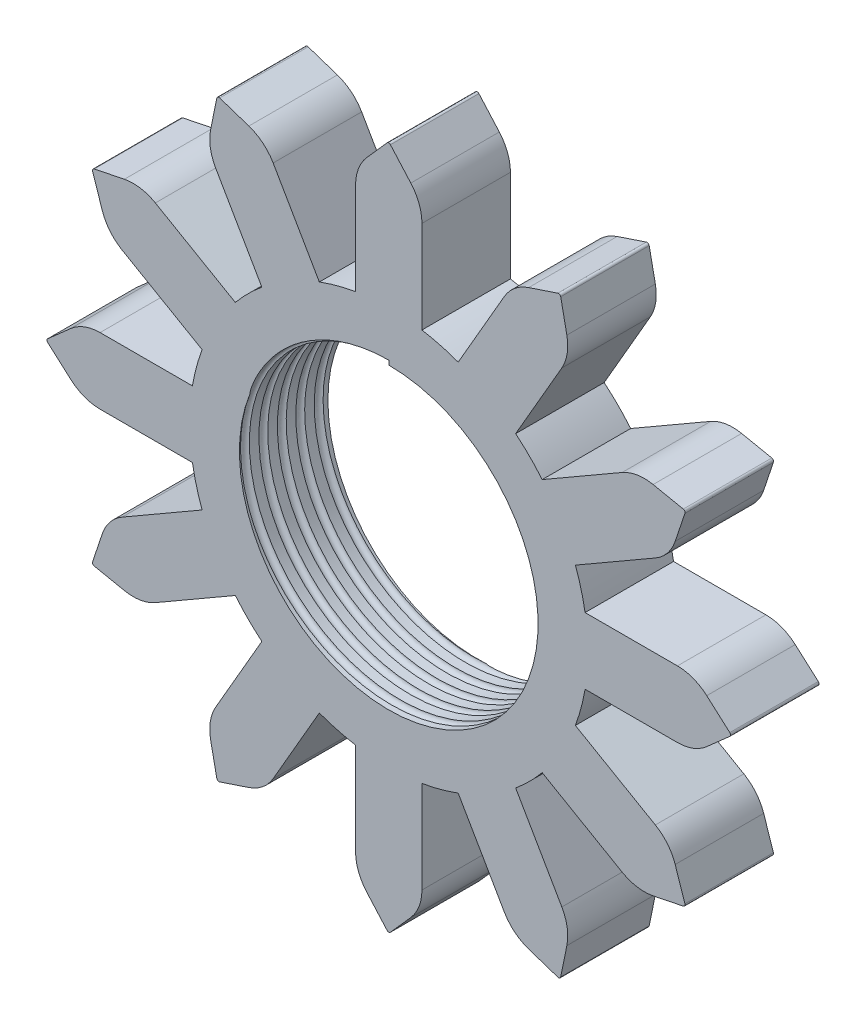
from build123d import *

# Parameters (mm, degrees)
SKETCH1_R           = 6.75
BOSS_EXTRUDE1_DEPTH = 4
CUT_SWEEP8_PITCH    = 0.8333333


with BuildPart() as part:
    # Sketch1 → Boss-Extrude1 (new body)
    with BuildSketch(Plane.XY):
        with BuildLine():
            Line((-0.074859453, 15.415479633), (-0.997189055, 14.374119675))
            ThreePointArc((-0.997189055, 14.374119675), (-1.370077286, 13.757155151), (-1.5, 13.048063517))
            Line((-1.5, 13.048063517), (-1.5, 8.874119675))
            ThreePointArc((-1.5, 8.874119675), (-2.329371406, 8.693332437), (-3.138021732, 8.435213074))
            Line((-3.138021732, 8.435213074), (-5.224993653, 12.049954476))
            ThreePointArc((-5.224993653, 12.049954476), (-5.692055841, 12.599084487), (-6.323468783, 12.946947323))
            Line((-6.323468783, 12.946947323), (-7.642909629, 13.3876267))
            ThreePointArc((-7.642909629, 13.3876267), (-7.724588412, 13.379379598), (-7.772570004, 13.312767247))
            Line((-7.772570004, 13.312767247), (-8.050650891, 11.949758268))
            ThreePointArc((-8.050650891, 11.949758268), (-8.06509931, 11.229007201), (-7.823069864, 10.549954476))
            Line((-7.823069864, 10.549954476), (-5.736097943, 6.935213074))
            ThreePointArc((-5.736097943, 6.935213074), (-6.363961031, 6.363961031), (-6.935213074, 5.736097943))
            Line((-6.935213074, 5.736097943), (-10.549954476, 7.823069864))
            ThreePointArc((-10.549954476, 7.823069864), (-11.229007201, 8.06509931), (-11.949758268, 8.050650891))
            Line((-11.949758268, 8.050650891), (-13.312767247, 7.772570004))
            ThreePointArc((-13.312767247, 7.772570004), (-13.379379598, 7.724588412), (-13.3876267, 7.642909629))
            Line((-13.3876267, 7.642909629), (-12.946947323, 6.323468783))
            ThreePointArc((-12.946947323, 6.323468783), (-12.599084487, 5.692055841), (-12.049954476, 5.224993653))
            Line((-12.049954476, 5.224993653), (-8.435213074, 3.138021732))
            ThreePointArc((-8.435213074, 3.138021732), (-8.693332437, 2.329371406), (-8.874119675, 1.5))
            Line((-8.874119675, 1.5), (-13.048063517, 1.5))
            ThreePointArc((-13.048063517, 1.5), (-13.757155151, 1.370077286), (-14.374119675, 0.997189055))
            Line((-14.374119675, 0.997189055), (-15.415479633, 0.074859453))
            ThreePointArc((-15.415479633, 0.074859453), (-15.449176825, 0), (-15.415479633, -0.074859453))
            Line((-15.415479633, -0.074859453), (-14.374119675, -0.997189055))
            ThreePointArc((-14.374119675, -0.997189055), (-13.757155151, -1.370077286), (-13.048063517, -1.5))
            Line((-13.048063517, -1.5), (-8.874119675, -1.5))
            ThreePointArc((-8.874119675, -1.5), (-8.693332437, -2.329371406), (-8.435213074, -3.138021732))
            Line((-8.435213074, -3.138021732), (-12.049954476, -5.224993653))
            ThreePointArc((-12.049954476, -5.224993653), (-12.599084487, -5.692055841), (-12.946947323, -6.323468783))
            Line((-12.946947323, -6.323468783), (-13.3876267, -7.642909629))
            ThreePointArc((-13.3876267, -7.642909629), (-13.379379598, -7.724588412), (-13.312767247, -7.772570004))
            Line((-13.312767247, -7.772570004), (-11.949758268, -8.050650891))
            ThreePointArc((-11.949758268, -8.050650891), (-11.229007201, -8.06509931), (-10.549954476, -7.823069864))
            Line((-10.549954476, -7.823069864), (-6.935213074, -5.736097943))
            ThreePointArc((-6.935213074, -5.736097943), (-6.363961031, -6.363961031), (-5.736097943, -6.935213074))
            Line((-5.736097943, -6.935213074), (-7.823069864, -10.549954476))
            ThreePointArc((-7.823069864, -10.549954476), (-8.06509931, -11.229007201), (-8.050650891, -11.949758268))
            Line((-8.050650891, -11.949758268), (-7.772570004, -13.312767247))
            ThreePointArc((-7.772570004, -13.312767247), (-7.724588412, -13.379379598), (-7.642909629, -13.3876267))
            Line((-7.642909629, -13.3876267), (-6.323468783, -12.946947323))
            ThreePointArc((-6.323468783, -12.946947323), (-5.692055841, -12.599084487), (-5.224993653, -12.049954476))
            Line((-5.224993653, -12.049954476), (-3.138021732, -8.435213074))
            ThreePointArc((-3.138021732, -8.435213074), (-2.329371406, -8.693332437), (-1.5, -8.874119675))
            Line((-1.5, -8.874119675), (-1.5, -13.048063517))
            ThreePointArc((-1.5, -13.048063517), (-1.370077286, -13.757155151), (-0.997189055, -14.374119675))
            Line((-0.997189055, -14.374119675), (-0.074859453, -15.415479633))
            ThreePointArc((-0.074859453, -15.415479633), (0, -15.449176825), (0.074859453, -15.415479633))
            Line((0.074859453, -15.415479633), (0.997189055, -14.374119675))
            ThreePointArc((0.997189055, -14.374119675), (1.370077286, -13.757155151), (1.5, -13.048063517))
            Line((1.5, -13.048063517), (1.5, -8.874119675))
            ThreePointArc((1.5, -8.874119675), (2.329371406, -8.693332437), (3.138021732, -8.435213074))
            Line((3.138021732, -8.435213074), (5.224993653, -12.049954476))
            ThreePointArc((5.224993653, -12.049954476), (5.692055841, -12.599084487), (6.323468783, -12.946947323))
            Line((6.323468783, -12.946947323), (7.642909629, -13.3876267))
            ThreePointArc((7.642909629, -13.3876267), (7.724588412, -13.379379598), (7.772570004, -13.312767247))
            Line((7.772570004, -13.312767247), (8.050650891, -11.949758268))
            ThreePointArc((8.050650891, -11.949758268), (8.06509931, -11.229007201), (7.823069864, -10.549954476))
            Line((7.823069864, -10.549954476), (5.736097943, -6.935213074))
            ThreePointArc((5.736097943, -6.935213074), (6.363961031, -6.363961031), (6.935213074, -5.736097943))
            Line((6.935213074, -5.736097943), (10.549954476, -7.823069864))
            ThreePointArc((10.549954476, -7.823069864), (11.229007201, -8.06509931), (11.949758268, -8.050650891))
            Line((11.949758268, -8.050650891), (13.312767247, -7.772570004))
            ThreePointArc((13.312767247, -7.772570004), (13.379379598, -7.724588412), (13.3876267, -7.642909629))
            Line((13.3876267, -7.642909629), (12.946947323, -6.323468783))
            ThreePointArc((12.946947323, -6.323468783), (12.599084487, -5.692055841), (12.049954476, -5.224993653))
            Line((12.049954476, -5.224993653), (8.435213074, -3.138021732))
            ThreePointArc((8.435213074, -3.138021732), (8.693332437, -2.329371406), (8.874119675, -1.5))
            Line((8.874119675, -1.5), (13.048063517, -1.5))
            ThreePointArc((13.048063517, -1.5), (13.757155151, -1.370077286), (14.374119675, -0.997189055))
            Line((14.374119675, -0.997189055), (15.415479633, -0.074859453))
            ThreePointArc((15.415479633, -0.074859453), (15.449176825, 0), (15.415479633, 0.074859453))
            Line((15.415479633, 0.074859453), (14.374119675, 0.997189055))
            ThreePointArc((14.374119675, 0.997189055), (13.757155151, 1.370077286), (13.048063517, 1.5))
            Line((13.048063517, 1.5), (8.874119675, 1.5))
            ThreePointArc((8.874119675, 1.5), (8.693332437, 2.329371406), (8.435213074, 3.138021732))
            Line((8.435213074, 3.138021732), (12.049954476, 5.224993653))
            ThreePointArc((12.049954476, 5.224993653), (12.599084487, 5.692055841), (12.946947323, 6.323468783))
            Line((12.946947323, 6.323468783), (13.3876267, 7.642909629))
            ThreePointArc((13.3876267, 7.642909629), (13.379379598, 7.724588412), (13.312767247, 7.772570004))
            Line((13.312767247, 7.772570004), (11.949758268, 8.050650891))
            ThreePointArc((11.949758268, 8.050650891), (11.229007201, 8.06509931), (10.549954476, 7.823069864))
            Line((10.549954476, 7.823069864), (6.935213074, 5.736097943))
            ThreePointArc((6.935213074, 5.736097943), (6.363961031, 6.363961031), (5.736097943, 6.935213074))
            Line((5.736097943, 6.935213074), (7.823069864, 10.549954476))
            ThreePointArc((7.823069864, 10.549954476), (8.06509931, 11.229007201), (8.050650891, 11.949758268))
            Line((8.050650891, 11.949758268), (7.772570004, 13.312767247))
            ThreePointArc((7.772570004, 13.312767247), (7.724588412, 13.379379598), (7.642909629, 13.3876267))
            Line((7.642909629, 13.3876267), (6.323468783, 12.946947323))
            ThreePointArc((6.323468783, 12.946947323), (5.692055841, 12.599084487), (5.224993653, 12.049954476))
            Line((5.224993653, 12.049954476), (3.138021732, 8.435213074))
            ThreePointArc((3.138021732, 8.435213074), (2.329371406, 8.693332437), (1.5, 8.874119675))
            Line((1.5, 8.874119675), (1.5, 13.048063517))
            ThreePointArc((1.5, 13.048063517), (1.370077286, 13.757155151), (0.997189055, 14.374119675))
            Line((0.997189055, 14.374119675), (0.074859453, 15.415479633))
            ThreePointArc((0.074859453, 15.415479633), (0, 15.449176825), (-0.074859453, 15.415479633))
        make_face()
        Circle(SKETCH1_R, mode=Mode.SUBTRACT)
    extrude(amount=BOSS_EXTRUDE1_DEPTH)

    # Cut-Sweep8: arcs per turn and ends read off the stored shape
    # Cut-Sweep8: the profile of Sketch4 screwed along a left-hand helix through 4.75 turns, 8 arcs to a turn; built about Z, then put on its axis
    cut_sweep8_z = Axis((0, 0, 0), (0, 0, 1))
    cut_sweep8_corners = [(6.75, 0, -0.2), (6.55, 0, 0), (6.75, 0, 0.2), (6.95, 0, 0)]
    with BuildLine(mode=Mode.PRIVATE) as cut_sweep8_profile:
        ThreePointArc((6.75, 0, -0.2), (6.608578644, 0, -0.141421356), (6.55, 0, 0))
        ThreePointArc((6.55, 0, 0), (6.608578644, 0, 0.141421356), (6.75, 0, 0.2))
        ThreePointArc((6.75, 0, 0.2), (6.891421356, 0, 0.141421356), (6.95, 0, 0))
        ThreePointArc((6.95, 0, 0), (6.891421356, 0, -0.141421356), (6.75, 0, -0.2))
    cut_sweep8_cap = Face(cut_sweep8_profile.wire())
    cut_sweep8_arcs = [((6.75, 0, -0.2), (6.55, 0, -0.2), (6.55, 0, 0), (1, 0.7071067811865476, 1)), ((6.55, 0, 0), (6.55, 0, 0.2), (6.75, 0, 0.2), (1, 0.7071067811865476, 1)), ((6.75, 0, 0.2), (6.95, 0, 0.2), (6.95, 0, 0), (1, 0.7071067811865476, 1)), ((6.95, 0, 0), (6.95, 0, -0.2), (6.75, 0, -0.2), (1, 0.7071067811865476, 1))]  # start, shoulder, end, weights
    cut_sweep8_turn_angles = [0, -22.5, -45, -67.5, -90, -112.5, -135, -157.5, -180, -202.5, -225, -247.5, -270, -292.5, -315, -337.5, -360]
    cut_sweep8_turn_weights = [1, 0.9238795325112867, 1, 0.9238795325112867, 1, 0.9238795325112867, 1, 0.9238795325112867, 1, 0.9238795325112867, 1, 0.9238795325112867, 1, 0.9238795325112867, 1, 0.9238795325112867, 1]
    cut_sweep8_turn_sides = [Face.make_bezier_surface([[Vector(p[j][0], p[j][1], 0).rotate(cut_sweep8_z, cut_sweep8_turn_angles[2 * i + k]) / cut_sweep8_turn_weights[2 * i + k] + Vector(0, 0, p[j][2] + -CUT_SWEEP8_PITCH * cut_sweep8_turn_angles[2 * i + k] / 360) for k in range(3)] for j in range(3)], [[p[3][j] * cut_sweep8_turn_weights[2 * i + k] for k in range(3)] for j in range(3)]) for p in cut_sweep8_arcs for i in range(8)]
    cut_sweep8_last_angles = [-1440, -1462.5, -1485, -1507.5, -1530, -1552.5, -1575, -1597.5, -1620, -1642.5, -1665, -1687.5, -1710]
    cut_sweep8_last_weights = [1, 0.9238795325112867, 1, 0.9238795325112867, 1, 0.9238795325112867, 1, 0.9238795325112867, 1, 0.9238795325112867, 1, 0.9238795325112776, 1]
    cut_sweep8_last_sides = [Face.make_bezier_surface([[Vector(p[j][0], p[j][1], 0).rotate(cut_sweep8_z, cut_sweep8_last_angles[2 * i + k]) / cut_sweep8_last_weights[2 * i + k] + Vector(0, 0, p[j][2] + -CUT_SWEEP8_PITCH * cut_sweep8_last_angles[2 * i + k] / 360) for k in range(3)] for j in range(3)], [[p[3][j] * cut_sweep8_last_weights[2 * i + k] for k in range(3)] for j in range(3)]) for p in cut_sweep8_arcs for i in range(6)]
    cut_sweep8 = Plane(origin=(0, 0, 0), x_dir=(1, 0, 0), z_dir=(0, 0, 1)) * Solid(Shell([*[p.moved(Location((0, 0, CUT_SWEEP8_PITCH * i))) for i in range(4) for p in cut_sweep8_turn_sides], *cut_sweep8_last_sides, cut_sweep8_cap, cut_sweep8_cap.rotate(cut_sweep8_z, -1710).moved(Location((0, 0, -CUT_SWEEP8_PITCH * -1710 / 360)))]))
    add(cut_sweep8, mode=Mode.SUBTRACT)


solid = part.part
